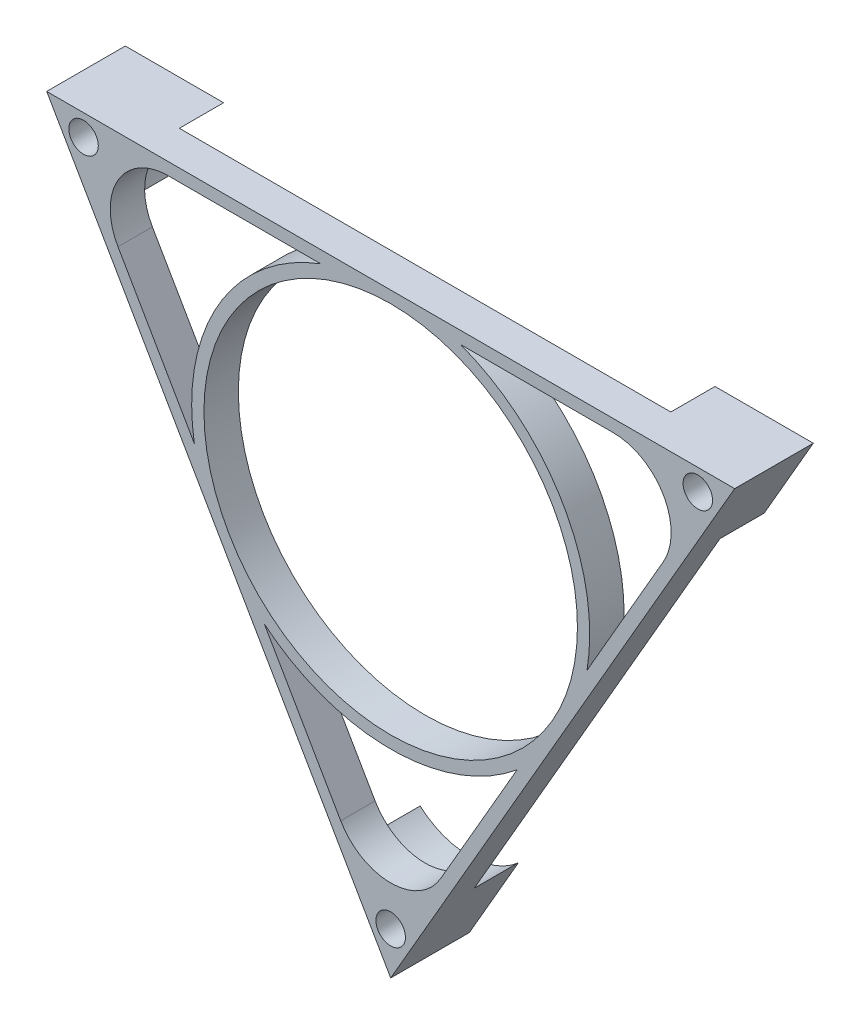
from build123d import *
from build123d.topology import SkipClean

# Parameters (mm, degrees)
SKETCH1_R           = 38
BOSS_EXTRUDE1_DEPTH = 2
BOSS_EXTRUDE2_DEPTH = 14
CIRPATTERN1_COUNT   = 3
CUT_EXTRUDE1_DEPTH  = 108.839386744
CIRPATTERN3_COUNT   = 3
BOSS_EXTRUDE5_START = 5
SKETCH8_R           = 38
BOSS_EXTRUDE5_DEPTH = 5
SKETCH6_R           = 1.65
CUT_EXTRUDE2_DEPTH  = 109.117220337
SKETCH11_R          = 3
CUT_EXTRUDE3_DEPTH  = 13
CHAMFER1_SIZE       = 2.2


with BuildPart() as part:
    # Sketch1 → Boss-Extrude1 (new body)
    with BuildSketch(Plane.XY):
        Polygon((0, -80.829037687), (70, 40.414518843), (-70, 40.414518843), align=None)
        Circle(SKETCH1_R, mode=Mode.SUBTRACT)
    extrude(amount=BOSS_EXTRUDE1_DEPTH)

    # Sketch2 → Boss-Extrude2 (add)
    with BuildSketch(Plane.XY):
        with BuildLine():
            Line((-50, 40.414518843), (-70, 40.414518843))
            Line((-70, 40.414518843), (-60, 23.094010768))
            ThreePointArc((-60, 23.094010768), (-58.307922691, 33.664094862), (-50, 40.414518843))
        make_face()
    boss_extrude2 = extrude(amount=-BOSS_EXTRUDE2_DEPTH)

    # CirPattern1: Boss-Extrude2 ×3 about axis
    cirpattern1_axis = Axis((0, 0, 0), (0, 0, 1))
    for i in range(1, CIRPATTERN1_COUNT):
        add(boss_extrude2.rotate(cirpattern1_axis, i * 360 / CIRPATTERN1_COUNT))

    # Sketch5 → Cut-Extrude1 (cut, symmetric)
    with BuildSketch(Plane(origin=(0, 0, 0), x_dir=(-1, 0, 0), z_dir=(0, 0, -1))):
        with BuildLine():
            Line((-55.493707308, 20.288882871), (-39.95426337, -6.62622355))
            ThreePointArc((-39.95426337, -6.62622355), (-35.074028853, 20.25), (-14.23865376, 37.914518843))
            Line((-14.23865376, 37.914518843), (-45.317541634, 37.914518843))
            ThreePointArc((-45.317541634, 37.914518843), (-55.493707308, 32.039306852), (-55.493707308, 20.288882871))
        make_face()
    cut_extrude1 = extrude(amount=CUT_EXTRUDE1_DEPTH, both=True, mode=Mode.SUBTRACT)

    # CirPattern3: Cut-Extrude1 ×3 about axis
    cirpattern3_axis = Axis((0, 0, 0), (0, 0, 1))
    for i in range(1, CIRPATTERN3_COUNT):
        add(cut_extrude1.rotate(cirpattern3_axis, i * 360 / CIRPATTERN3_COUNT), mode=Mode.SUBTRACT)

    # Sketch8 → Boss-Extrude5 (add)
    with SkipClean():  # the faces are left unmerged after this step: merging them gives an invalid solid
        with BuildSketch(Plane(origin=(0, 0, 0), x_dir=(-1, 0, 0), z_dir=(0, 0, -1)).offset(BOSS_EXTRUDE5_START)):
            with BuildLine():
                Line((-60, 23.094010768), (-10, -63.508529611))
                ThreePointArc((-10, -63.508529611), (0, -67.328189723), (10, -63.508529611))
                Line((10, -63.508529611), (60, 23.094010768))
                ThreePointArc((60, 23.094010768), (58.307922691, 33.664094862), (50, 40.414518843))
                Line((50, 40.414518843), (-50, 40.414518843))
                ThreePointArc((-50, 40.414518843), (-58.307922691, 33.664094862), (-60, 23.094010768))
            make_face()
            Circle(SKETCH8_R, mode=Mode.SUBTRACT)
            with BuildLine():
                Line((-39.95426337, -6.62622355), (-55.493707308, 20.288882871))
                ThreePointArc((-55.493707308, 20.288882871), (-55.493707308, 32.039306852), (-45.317541634, 37.914518843))
                Line((-45.317541634, 37.914518843), (-14.23865376, 37.914518843))
                ThreePointArc((-14.23865376, 37.914518843), (-35.074028853, 20.25), (-39.95426337, -6.62622355))
            make_face(mode=Mode.SUBTRACT)
            with BuildLine():
                Line((14.23865376, 37.914518843), (45.317541634, 37.914518843))
                ThreePointArc((45.317541634, 37.914518843), (55.493707308, 32.039306852), (55.493707308, 20.288882871))
                Line((55.493707308, 20.288882871), (39.95426337, -6.62622355))
                ThreePointArc((39.95426337, -6.62622355), (35.074028853, 20.25), (14.23865376, 37.914518843))
            make_face(mode=Mode.SUBTRACT)
            with BuildLine():
                Line((25.715609611, -31.288295293), (10.176165673, -58.203401714))
                ThreePointArc((10.176165673, -58.203401714), (0, -64.078613705), (-10.176165673, -58.203401714))
                Line((-10.176165673, -58.203401714), (-25.715609611, -31.288295293))
                ThreePointArc((-25.715609611, -31.288295293), (0, -40.5), (25.715609611, -31.288295293))
            make_face(mode=Mode.SUBTRACT)
        extrude(amount=-BOSS_EXTRUDE5_DEPTH)

    # Sketch6 → Cut-Extrude2 (cut, through all)
    with SkipClean():  # the faces are left unmerged after this step: merging them gives an invalid solid
        with BuildSketch(Plane.XY.offset(2)):
            with Locations((-62.5, 36.084391824)):
                Circle(SKETCH6_R)
            with Locations((62.5, 36.084391824)):
                Circle(SKETCH6_R)
            with Locations((0, -72.168783649)):
                Circle(SKETCH6_R)
        extrude(amount=-CUT_EXTRUDE2_DEPTH, mode=Mode.SUBTRACT)

    # Sketch11 → Cut-Extrude3 (cut)
    with SkipClean():  # the faces are left unmerged after this step: merging them gives an invalid solid
        with BuildSketch(Plane.XY.offset(2)):
            with Locations((-62.5, 36.084391824)):
                Circle(SKETCH11_R)
            with Locations((62.5, 36.084391824)):
                Circle(SKETCH11_R)
            with Locations((0, -72.168783649)):
                Circle(SKETCH11_R)
        extrude(amount=-CUT_EXTRUDE3_DEPTH, mode=Mode.SUBTRACT)

    # Chamfer1
    # the kernel refuses this chamfer: 2.2 mm, written as the material it takes off along each edge
    with BuildSketch(Plane(origin=(0, -72.168783649, -11), x_dir=(1, 0, 0), z_dir=(0, -1, 0))) as chamfer1_piece_1_section:
        Polygon((1.65, -CHAMFER1_SIZE), (1.65 + CHAMFER1_SIZE, 0), (1.65, 0), align=None)
    chamfer1_piece_1 = revolve(axis=Axis((0, -72.168783649, -11), (0, 0, 1)), mode=Mode.PRIVATE)
    chamfer1_piece_1 = chamfer1_piece_1 & Plane(origin=(0, -72.168783649, -12.533940938), x_dir=(1, 0, 0), z_dir=(0, 0, 1)) * Cylinder(3, 16, mode=Mode.PRIVATE)
    add(chamfer1_piece_1, mode=Mode.SUBTRACT)
    with BuildSketch(Plane(origin=(62.5, 36.084391824, -11), x_dir=(1, 0, 0), z_dir=(0, -1, 0))) as chamfer1_piece_2_section:
        Polygon((1.65, -CHAMFER1_SIZE), (1.65 + CHAMFER1_SIZE, 0), (1.65, 0), align=None)
    chamfer1_piece_2 = revolve(axis=Axis((62.5, 36.084391824, -11), (0, 0, 1)), mode=Mode.PRIVATE)
    chamfer1_piece_2 = chamfer1_piece_2 & Plane(origin=(62.5, 36.084391824, -12.533940938), x_dir=(1, 0, 0), z_dir=(0, 0, 1)) * Cylinder(3, 16, mode=Mode.PRIVATE)
    add(chamfer1_piece_2, mode=Mode.SUBTRACT)
    with BuildSketch(Plane(origin=(-62.5, 36.084391824, -11), x_dir=(1, 0, 0), z_dir=(0, -1, 0))) as chamfer1_piece_3_section:
        Polygon((1.65, -CHAMFER1_SIZE), (1.65 + CHAMFER1_SIZE, 0), (1.65, 0), align=None)
    chamfer1_piece_3 = revolve(axis=Axis((-62.5, 36.084391824, -11), (0, 0, 1)), mode=Mode.PRIVATE)
    chamfer1_piece_3 = chamfer1_piece_3 & Plane(origin=(-62.5, 36.084391824, -12.533940938), x_dir=(1, 0, 0), z_dir=(0, 0, 1)) * Cylinder(3, 16, mode=Mode.PRIVATE)
    add(chamfer1_piece_3, mode=Mode.SUBTRACT)


solid = part.part
